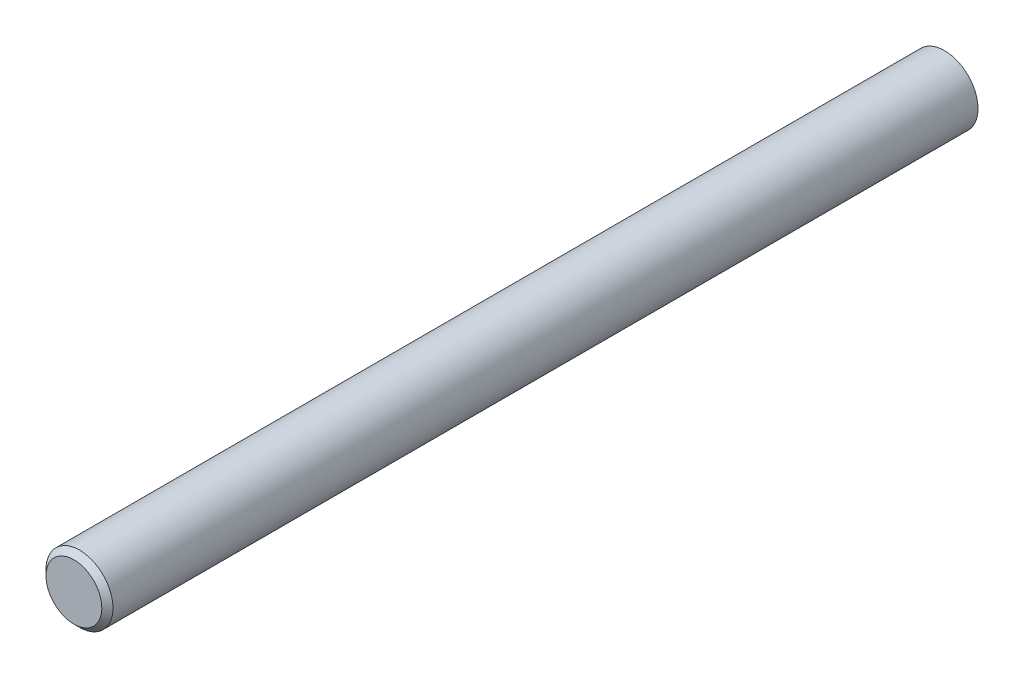
from build123d import *

# Parameters (mm, degrees)
FASE1_SIZE = 0.5


with BuildPart() as part:
    # Skizze1 → Rotation1 (revolve)
    with BuildSketch(Plane(origin=(0, 0, 0), x_dir=(0, 0, -1), z_dir=(1, 0, 0))):
        Polygon((7, 3), (2, 3), (-22, 3), (-22, 0), (0, 0), (56, 0), (56, 3), align=None)
    revolve(axis=Axis((0, 0, 22), (0, 0, -1)))

    # Fase1
    fase1_edges = [part.edges().sort_by_distance(p)[0] for p in [
        (0, -3, 22),
    ]]
    chamfer(fase1_edges, length=FASE1_SIZE)


solid = part.part
